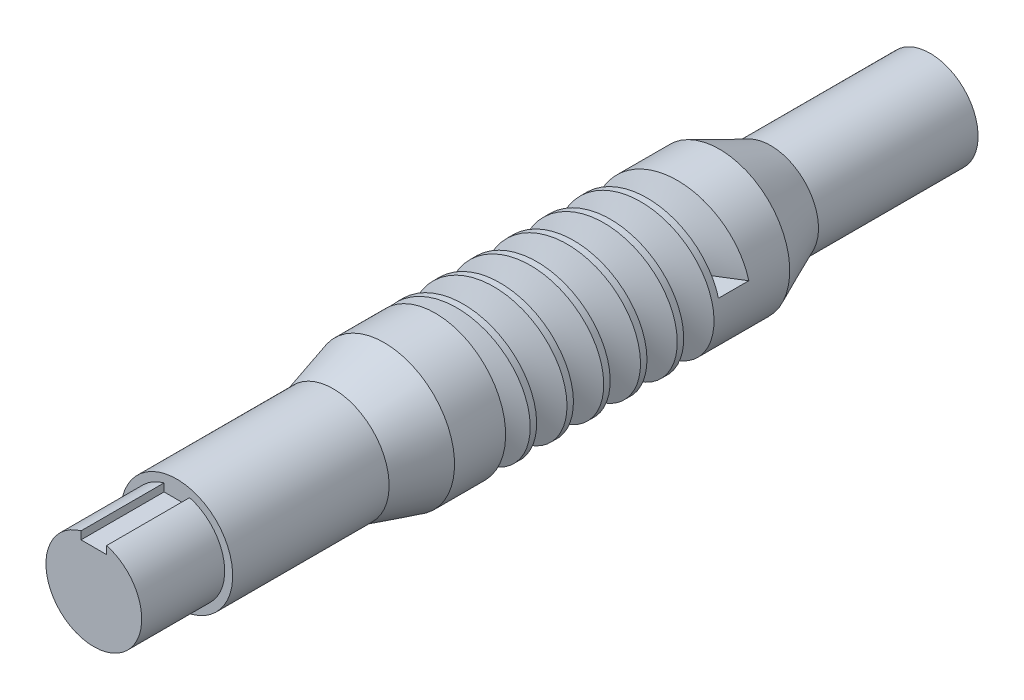
from build123d import *

# Parameters (mm, degrees)
CROQUIS19_W             = 105
CROQUIS19_H             = 22
CORTAR_BARRER1_PITCH    = 11.515151515
SALIENTE_EXTRUIR1_REACH = 96.282
CROQUIS23_R             = 22
CORTAR_EXTRUIR1_DEPTH   = 26


with BuildPart() as part:
    # Croquis19 → Revolución2 (revolve)
    with BuildSketch(Plane(origin=(0, 0, 0), x_dir=(0, 0, -1), z_dir=(1, 0, 0)), mode=Mode.PRIVATE) as revoluci_n2_sk:
        with Locations((0, 11)):
            Rectangle(CROQUIS19_W, CROQUIS19_H)
    revolve(revoluci_n2_sk.sketch.rotate(Axis((0, 0, 0), (0, 0, 1)), 90), axis=Axis((0, 0, 0), (0, 0, 1)))

    # Cortar-Barrer1: arcs per turn and ends read off the stored shape
    # Cortar-Barrer1: the profile of Croquis22 profile screwed along a right-hand helix through 6.6 turns, 16 arcs to a turn; built about Z, then put on its axis
    cortar_barrer1_z = Axis((0, 0, 0), (0, 0, 1))
    cortar_barrer1_corners = [(22.0003, 4.6077e-05, -9.068286313), (22.0003, 4.6077e-05, 0.431930354), (13, 2.7227e-05, -2.81817798), (13, 2.7227e-05, -5.81817798)]
    with BuildLine(mode=Mode.PRIVATE) as cortar_barrer1_profile:
        Line(cortar_barrer1_corners[0], cortar_barrer1_corners[1])
        Line(cortar_barrer1_corners[1], cortar_barrer1_corners[2])
        Line(cortar_barrer1_corners[2], cortar_barrer1_corners[3])
        Line(cortar_barrer1_corners[3], cortar_barrer1_corners[0])
    cortar_barrer1_cap = Face(cortar_barrer1_profile.wire())
    cortar_barrer1_turn_angles = [0, 11.25, 22.5, 33.75, 45, 56.25, 67.5, 78.75, 90, 101.25, 112.5, 123.75, 135, 146.25, 157.5, 168.75, 180, 191.25, 202.5, 213.75, 225, 236.25, 247.5, 258.75, 270, 281.25, 292.5, 303.75, 315, 326.25, 337.5, 348.75, 360]
    cortar_barrer1_turn_weights = [1, 0.9807852804032304, 1, 0.9807852804032304, 1, 0.9807852804032304, 1, 0.9807852804032304, 1, 0.9807852804032304, 1, 0.9807852804032304, 1, 0.9807852804032304, 1, 0.9807852804032304, 1, 0.9807852804032304, 1, 0.9807852804032304, 1, 0.9807852804032304, 1, 0.9807852804032304, 1, 0.9807852804032304, 1, 0.9807852804032304, 1, 0.9807852804032304, 1, 0.9807852804032304, 1]
    cortar_barrer1_turn_rails = [Edge.make_bspline([Vector(p[0], p[1], 0).rotate(cortar_barrer1_z, cortar_barrer1_turn_angles[k]) / cortar_barrer1_turn_weights[k] + Vector(0, 0, p[2] + CORTAR_BARRER1_PITCH * cortar_barrer1_turn_angles[k] / 360) for k in range(33)], [0, 0, 0, 1, 1, 2, 2, 3, 3, 4, 4, 5, 5, 6, 6, 7, 7, 8, 8, 9, 9, 10, 10, 11, 11, 12, 12, 13, 13, 14, 14, 15, 15, 16, 16, 16], 2, cortar_barrer1_turn_weights) for p in cortar_barrer1_corners]
    cortar_barrer1_turn_sides = [Face.make_surface_from_curves(cortar_barrer1_turn_rails[p[0]], cortar_barrer1_turn_rails[p[1]]) for p in [(0, 1), (1, 2), (2, 3), (3, 0)]]
    cortar_barrer1_last_angles = [2160, 2171.25, 2182.5, 2193.75, 2205, 2216.25, 2227.5, 2238.75, 2250, 2261.25, 2272.5, 2283.75, 2295, 2306.25, 2317.5, 2328.75, 2340, 2351.25, 2362.5, 2369.25, 2376]
    cortar_barrer1_last_weights = [1, 0.9807852804032304, 1, 0.9807852804032304, 1, 0.9807852804032304, 1, 0.9807852804032304, 1, 0.9807852804032304, 1, 0.9807852804032304, 1, 0.9807852804032304, 1, 0.9807852804032304, 1, 0.9807852804032304, 1, 0.9930684569549179, 1]
    cortar_barrer1_last_rails = [Edge.make_bspline([Vector(p[0], p[1], 0).rotate(cortar_barrer1_z, cortar_barrer1_last_angles[k]) / cortar_barrer1_last_weights[k] + Vector(0, 0, p[2] + CORTAR_BARRER1_PITCH * cortar_barrer1_last_angles[k] / 360) for k in range(21)], [0, 0, 0, 1, 1, 2, 2, 3, 3, 4, 4, 5, 5, 6, 6, 7, 7, 8, 8, 9, 9, 10, 10, 10], 2, cortar_barrer1_last_weights) for p in cortar_barrer1_corners]
    cortar_barrer1_last_sides = [Face.make_surface_from_curves(cortar_barrer1_last_rails[p[0]], cortar_barrer1_last_rails[p[1]]) for p in [(0, 1), (1, 2), (2, 3), (3, 0)]]
    cortar_barrer1 = Plane(origin=(0, 0, 36.5), x_dir=(-0.7071067811865414, -0.7071067811865537, 0), z_dir=(0, 0, -1)) * Solid(Shell([*[p.moved(Location((0, 0, CORTAR_BARRER1_PITCH * i))) for i in range(6) for p in cortar_barrer1_turn_sides], *cortar_barrer1_last_sides, cortar_barrer1_cap, cortar_barrer1_cap.rotate(cortar_barrer1_z, 2376).moved(Location((0, 0, CORTAR_BARRER1_PITCH * 2376 / 360)))]))
    add(cortar_barrer1, mode=Mode.SUBTRACT)

    # Croquis23 → Saliente-Extruir1 (add, up to next)
    with BuildSketch(Plane.XY.offset(36.5), mode=Mode.PRIVATE) as saliente_extruir1_sk1:
        with Locations(Location((0, 0, 0), (0, 0, 180))):
            Circle(CROQUIS23_R)
    saliente_extruir1_tool1 = extrude(saliente_extruir1_sk1.sketch, amount=SALIENTE_EXTRUIR1_REACH, mode=Mode.PRIVATE) - part.part
    add(saliente_extruir1_tool1.solids().sort_by_distance((0, 0, 36.5))[0])

    # Croquis24 → Revolución3 (revolve)
    with BuildSketch(Plane(origin=(0, 0, 0), x_dir=(0, 0, -1), z_dir=(1, 0, 0)), mode=Mode.PRIVATE) as revoluci_n3_sk:
        Polygon((-52.5, 22), (-68.5, 17.5), (-117.5, 17.5), (-117.5, 15), (-143.5, 15), (-143.5, 0), (-52.5, 0), align=None)
        Polygon((52.5, 0), (52.5, 22), (68.5, 15), (118.5, 15), (118.5, 0), align=None)
    revolve(revoluci_n3_sk.sketch.rotate(Axis((0, 0, -266.57995153), (0, 0, 1)), 90), axis=Axis((0, 0, -266.57995153), (0, 0, 1)))

    # Croquis25 → Cortar-Extruir1 (cut)
    with BuildSketch(Plane.XY.offset(143.5)):
        with BuildLine():
            Line((-4, 14.456832295), (-4, 12))
            Line((-4, 12), (4, 12))
            Line((4, 12), (4, 14.456832295))
            ThreePointArc((4, 14.456832295), (0, 15), (-4, 14.456832295))
        make_face()
    extrude(amount=-CORTAR_EXTRUIR1_DEPTH, mode=Mode.SUBTRACT)


solid = part.part
